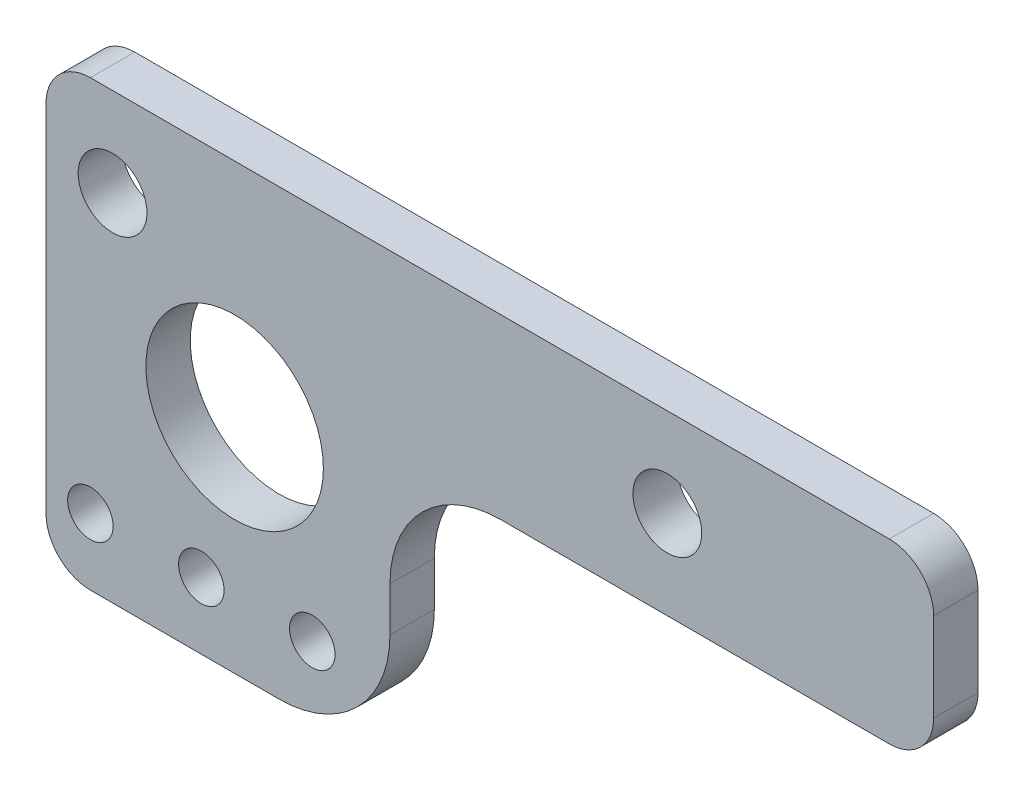
from build123d import *

# Parameters (mm, degrees)
SKETCH_2_W          = 31
SKETCH_2_H          = 8
EXTRUDE_1_DEPTH     = 2
SKETCH_3_R          = 1.55
CUT_EXTRUDE_1_DEPTH = 2
SKETCH_4_W          = 4
SKETCH_4_H          = 12
EXTRUDE_2_DEPTH     = 2
SKETCH_5_R          = 1.025
CUT_EXTRUDE_2_DEPTH = 2
SKETCH_6_W          = 9
SKETCH_6_H          = 8
EXTRUDE_3_DEPTH     = 2
FILLET_1_R          = 2
EXTRUDE_START       = -2
EXTRUDE_4_OUTLINE_R = 1.025
EXTRUDE_4_DEPTH     = 2
FILLET_2_R          = 5
SKETCH_8_R          = 4
CUT_EXTRUDE_3_DEPTH = 2


# Read off the part's stored shape, not the designer's step: 凸台-拉伸4
with BuildPart() as part:
    # 草图2 → 凸台-拉伸1 (new body)
    with BuildSketch(Plane.XY):
        Rectangle(SKETCH_2_W, SKETCH_2_H)
    extrude(amount=EXTRUDE_1_DEPTH)

    # 草图3 → 切除-拉伸1 (cut)
    with BuildSketch(Plane.XY.offset(2)):
        with Locations((12.5, 0)):
            Circle(SKETCH_3_R)
        with Locations((-12.5, 0)):
            Circle(SKETCH_3_R)
    extrude(amount=-CUT_EXTRUDE_1_DEPTH, mode=Mode.SUBTRACT)

    # 草图4 → 凸台-拉伸2 (add)
    with BuildSketch(Plane.XY.offset(2)):
        with Locations((-13.5, -10)):
            Rectangle(SKETCH_4_W, SKETCH_4_H)
    extrude(amount=-EXTRUDE_2_DEPTH)

    # 草图5 → 切除-拉伸2 (cut)
    with BuildSketch(Plane.XY.offset(2)):
        with Locations((-13.5, -13)):
            Circle(SKETCH_5_R)
    extrude(amount=-CUT_EXTRUDE_2_DEPTH, mode=Mode.SUBTRACT)

    # 草图6 → 凸台-拉伸3 (add)
    with BuildSketch(Plane.XY.offset(2)):
        with Locations((20, 0)):
            Rectangle(SKETCH_6_W, SKETCH_6_H)
    extrude(amount=-EXTRUDE_3_DEPTH)

    # 圆角1
    fillet_1_edges = [part.edges().sort_by_distance(p)[0] for p in [
        (-15.5, -16, 1),
        (-11.5, -16, 1),
        (-11.5, -4, 1),
        (-15.5, 4, 1),
        (24.5, -4, 1),
        (24.5, 4, 1),
    ]]
    fillet(fillet_1_edges, radius=FILLET_1_R - 0.0001)  # a hair under: the kernel refuses the full size

    # 凸台-拉伸4 outline → 凸台-拉伸4 (add)
    with BuildSketch(Plane.XY.offset(2).offset(EXTRUDE_START)):
        with BuildLine():
            Line((-13.5, -16), (0, -16))
            Line((0, -16), (0, -4))
            Line((0, -4), (-11.499999994, -4))
            Line((-11.499999994, -4), (-11.5, -14))
            ThreePointArc((-11.5, -14), (-12.085786438, -15.414213562), (-13.5, -16))
        make_face()
        with Locations((-8.5, -13)):
            Circle(EXTRUDE_4_OUTLINE_R, mode=Mode.SUBTRACT)
        with Locations((-3.5, -13)):
            Circle(EXTRUDE_4_OUTLINE_R, mode=Mode.SUBTRACT)
    extrude(amount=EXTRUDE_4_DEPTH)

    # 圆角2
    fillet_2_edges = [part.edges().sort_by_distance(p)[0] for p in [
        (0, -4, 1),
        (0, -16, 1),
    ]]
    fillet(fillet_2_edges, radius=FILLET_2_R)

    # 草图8 → 切除-拉伸3 (cut)
    with BuildSketch(Plane.XY.offset(2)):
        with Locations((-7, -6)):
            Circle(SKETCH_8_R)
    extrude(amount=-CUT_EXTRUDE_3_DEPTH, mode=Mode.SUBTRACT)


solid = part.part
